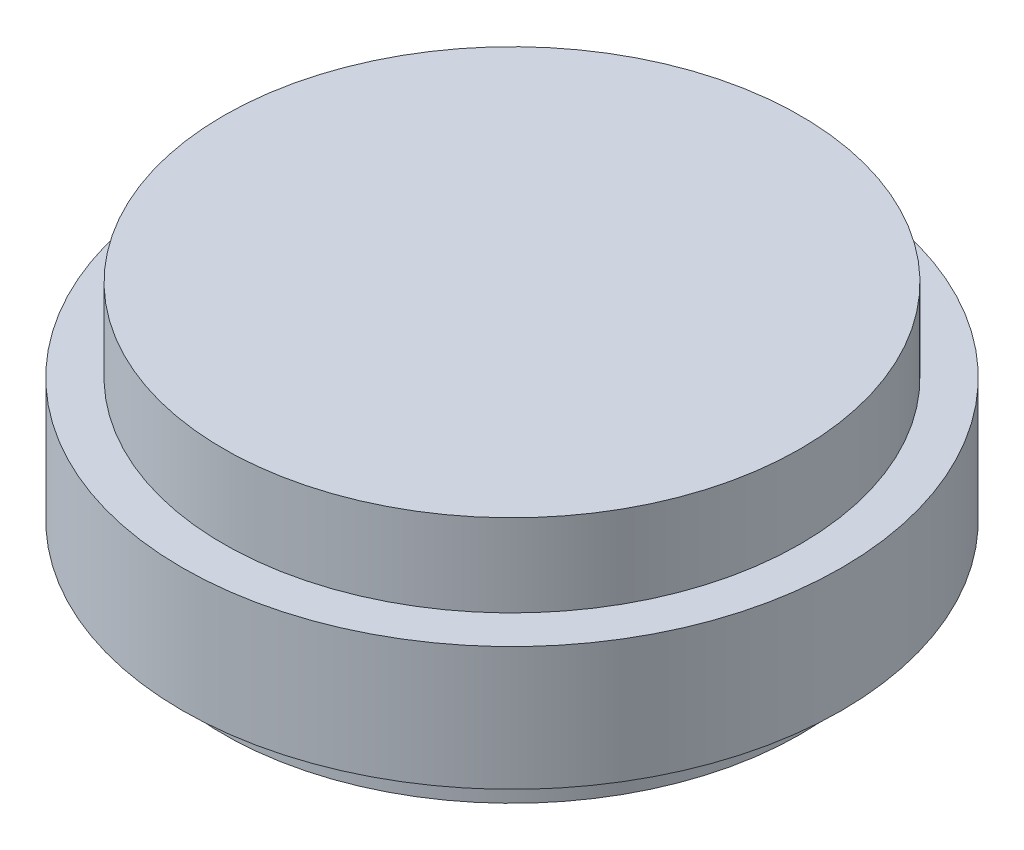
from build123d import *


with BuildPart() as part:
    # Esquisse1 → Révolution1 (revolve)
    with BuildSketch(Plane.XY):
        Polygon((0, 0), (3.5, 0), (3.5, 0.5), (4, 0.5), (4, 2), (3.5, 2), (3.5, 3), (0, 3), align=None)
    revolve(axis=Axis((0, 3, 0), (0, -1, 0)))


solid = part.part
